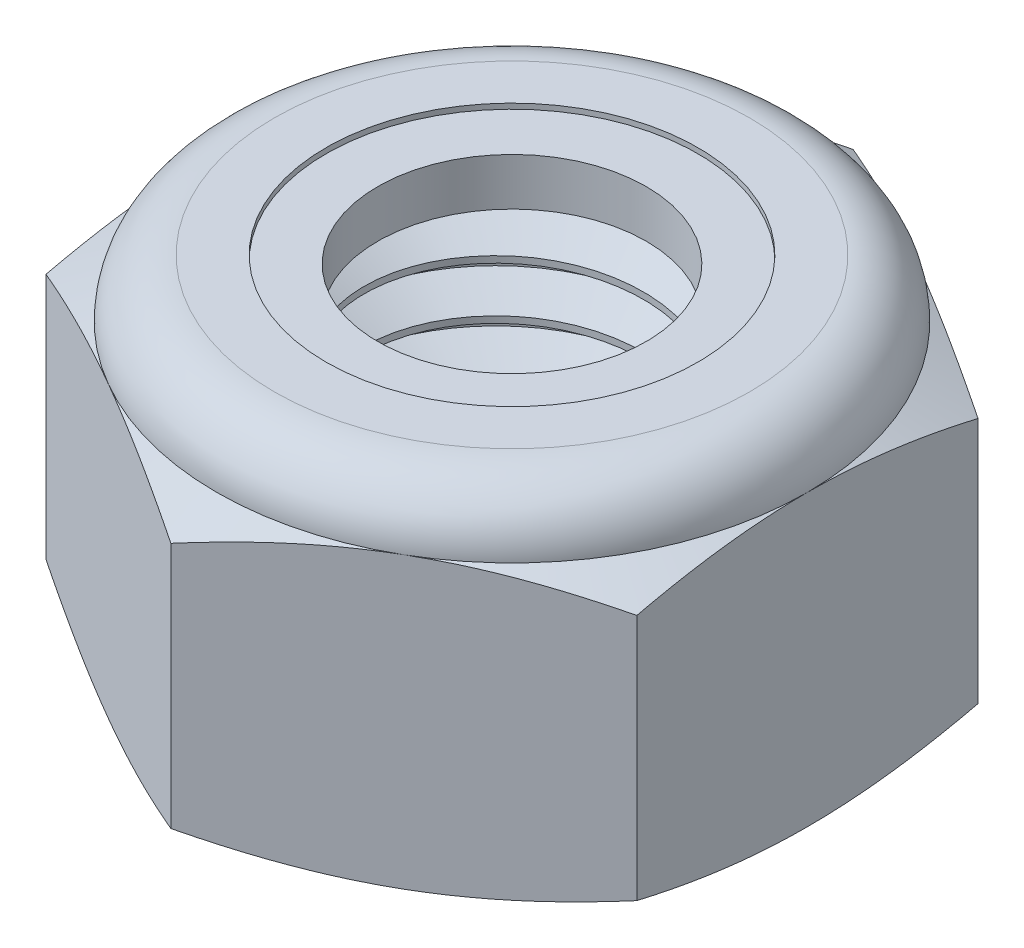
from build123d import *

# Parameters (mm, degrees)
EXTRUDE1_DEPTH   = 10
SKETCH2_W        = 5
SKETCH2_H        = 10
CUT_SWEEP1_PITCH = 1.5


with BuildPart() as part:
    # Sketch1 → Extrude1 (new body)
    with BuildSketch(Plane(origin=(0, 0, 0), x_dir=(1, 0, 0), z_dir=(0, 1, 0))):
        Polygon((0, 9.814954576), (-8.5, 4.907477288), (-8.5, -4.907477288), (0, -9.814954576), (8.5, -4.907477288), (8.5, 4.907477288), align=None)
    extrude(amount=EXTRUDE1_DEPTH)


with BuildPart() as body_2:
    # Sketch2 → Revolve1 (revolve)
    with BuildSketch(Plane(origin=(0, 0, 0), x_dir=(0, 0, -1), z_dir=(1, 0, 0))):
        with Locations((2.5, 5)):
            Rectangle(SKETCH2_W, SKETCH2_H)
    revolve(axis=Axis((0, -5, 0), (0, 1, 0)))

    # Boss-Extrude1 cone 1 section (through the dimple's axis) → Boss-Extrude1 (revolve)
    with BuildSketch(Plane(origin=(0, 0, 0), x_dir=(0, 0, -1), z_dir=(1, 0, 0))):
        Polygon((0, 0), (5, 0), (0, 5), align=None)
    revolve(axis=Axis((0, 0, 0), (0, 1, 0)))

    # Boss-Extrude2 cone 1 section (through the dimple's axis) → Boss-Extrude2 (revolve)
    with BuildSketch(Plane(origin=(0, 10, 0), x_dir=(0, 0, 1), z_dir=(1, 0, 0))):
        Polygon((0, 0), (5, 0), (0, 5), align=None)
    revolve(axis=Axis((0, 10, 0), (0, -1, 0)))

    # Cut-Sweep1: the profile of Sketch9 profile screwed along a right-hand helix of 7.666667 turns, 8 arcs to a turn; built about Z, then put on its axis
    cut_sweep1_z = Axis((0, 0, 0), (0, 0, 1))
    cut_sweep1_corners = [(5.0003, 0, -1.312673205), (5.0003, 0, 0.000173205), (4.025721421, 0, -0.5625), (4.025721421, 0, -0.75)]
    with BuildLine(mode=Mode.PRIVATE) as cut_sweep1_profile:
        Line(cut_sweep1_corners[0], cut_sweep1_corners[1])
        Line(cut_sweep1_corners[1], cut_sweep1_corners[2])
        Line(cut_sweep1_corners[2], cut_sweep1_corners[3])
        Line(cut_sweep1_corners[3], cut_sweep1_corners[0])
    cut_sweep1_cap = Face(cut_sweep1_profile.wire())
    cut_sweep1_turn_angles = [0, 22.5, 45, 67.5, 90, 112.5, 135, 157.5, 180, 202.5, 225, 247.5, 270, 292.5, 315, 337.5, 360]
    cut_sweep1_turn_weights = [1, 0.9238795325112867, 1, 0.9238795325112867, 1, 0.9238795325112867, 1, 0.9238795325112867, 1, 0.9238795325112867, 1, 0.9238795325112867, 1, 0.9238795325112867, 1, 0.9238795325112867, 1]
    cut_sweep1_turn_rails = [Edge.make_bspline([Vector(p[0], p[1], 0).rotate(cut_sweep1_z, cut_sweep1_turn_angles[k]) / cut_sweep1_turn_weights[k] + Vector(0, 0, p[2] + CUT_SWEEP1_PITCH * cut_sweep1_turn_angles[k] / 360) for k in range(17)], [0, 0, 0, 1, 1, 2, 2, 3, 3, 4, 4, 5, 5, 6, 6, 7, 7, 8, 8, 8], 2, cut_sweep1_turn_weights) for p in cut_sweep1_corners]
    cut_sweep1_turn_sides = [Face.make_surface_from_curves(cut_sweep1_turn_rails[p[0]], cut_sweep1_turn_rails[p[1]]) for p in [(0, 1), (1, 2), (2, 3), (3, 0)]]
    cut_sweep1_last_angles = [2520, 2542.5, 2565, 2587.5, 2610, 2632.5, 2655, 2677.5, 2700, 2722.5, 2745, 2752.5, 2760]
    cut_sweep1_last_weights = [1, 0.9238795325112867, 1, 0.9238795325112867, 1, 0.9238795325112867, 1, 0.9238795325112867, 1, 0.9238795325112867, 1, 0.9914448613738063, 1]
    cut_sweep1_last_rails = [Edge.make_bspline([Vector(p[0], p[1], 0).rotate(cut_sweep1_z, cut_sweep1_last_angles[k]) / cut_sweep1_last_weights[k] + Vector(0, 0, p[2] + CUT_SWEEP1_PITCH * cut_sweep1_last_angles[k] / 360) for k in range(13)], [0, 0, 0, 1, 1, 2, 2, 3, 3, 4, 4, 5, 5, 6, 6, 6], 2, cut_sweep1_last_weights) for p in cut_sweep1_corners]
    cut_sweep1_last_sides = [Face.make_surface_from_curves(cut_sweep1_last_rails[p[0]], cut_sweep1_last_rails[p[1]]) for p in [(0, 1), (1, 2), (2, 3), (3, 0)]]
    cut_sweep1 = Plane(origin=(0, 0, 0), x_dir=(0, 0, -1), z_dir=(0, 1, 0)) * Solid(Shell([*[p.moved(Location((0, 0, CUT_SWEEP1_PITCH * i))) for i in range(7) for p in cut_sweep1_turn_sides], *cut_sweep1_last_sides, cut_sweep1_cap, cut_sweep1_cap.rotate(cut_sweep1_z, 2760).moved(Location((0, 0, CUT_SWEEP1_PITCH * 2760 / 360)))]))
    add(cut_sweep1, mode=Mode.SUBTRACT)


with BuildPart() as part_1:
    add(part.part)

    # Combine1: cut body 2
    add(body_2.part, mode=Mode.SUBTRACT)

    # Sketch5 → Cut-Revolve3 (revolve, cut)
    with BuildSketch(Plane(origin=(0, 0, 0), x_dir=(0, 0, -1), z_dir=(1, 0, 0))):
        with BuildLine():
            Line((0, 0), (8.5, 0))
            Line((8.5, 0), (9.814954576, 0.613173389))
            Line((9.814954576, 0.613173389), (9.814954576, 7.720159944))
            Line((9.814954576, 7.720159944), (8.5, 8.333333333))
            ThreePointArc((8.5, 8.333333333), (8.011844635, 9.511844635), (6.833333333, 10))
            Line((6.833333333, 10), (6.833333333, 11.27))
            Line((6.833333333, 11.27), (11.084954576, 11.27))
            Line((11.084954576, 11.27), (11.084954576, -1.27))
            Line((11.084954576, -1.27), (0, -1.27))
            Line((0, -1.27), (0, 0))
        make_face()
    revolve(axis=Axis((0, 0, 0), (0, 1, 0)), mode=Mode.SUBTRACT)

    # Sketch6 → Cut-Revolve4 (revolve, cut)
    with BuildSketch(Plane(origin=(0, 0, 0), x_dir=(0, 0, -1), z_dir=(1, 0, 0)), mode=Mode.PRIVATE) as cut_revolve4_sk:
        with BuildLine():
            Line((0, 8.333333333), (8.3476, 8.333333333))
            ThreePointArc((8.3476, 8.333333333), (7.904081562, 9.404081562), (6.833333333, 9.8476))
            Line((6.833333333, 9.8476), (5.348337495, 9.8476))
            Line((5.348337495, 9.8476), (5.348337495, 11.27))
            Line((5.348337495, 11.27), (0, 11.27))
            Line((0, 11.27), (0, 8.333333333))
        make_face()
    revolve(cut_revolve4_sk.sketch.rotate(Axis((0, 11.27, 0), (0, -1, 0)), 180), axis=Axis((0, 11.27, 0), (0, -1, 0)), mode=Mode.SUBTRACT)


with BuildPart() as body_2_2:
    # Sketch7 → Revolve2 (revolve)
    with BuildSketch(Plane(origin=(0, 0, 0), x_dir=(0, 0, -1), z_dir=(1, 0, 0))):
        with BuildLine():
            Line((3.863341658, 8.409533333), (8.269379745, 8.409533333))
            ThreePointArc((8.269379745, 8.409533333), (7.822892593, 9.376793064), (6.833333333, 9.7714))
            Line((6.833333333, 9.7714), (3.863341658, 9.7714))
            Line((3.863341658, 9.7714), (3.863341658, 8.409533333))
        make_face()
    revolve(axis=Axis((0, 8.409533333, 0), (0, 1, 0)))


solid = Compound([part_1.part, body_2_2.part])
